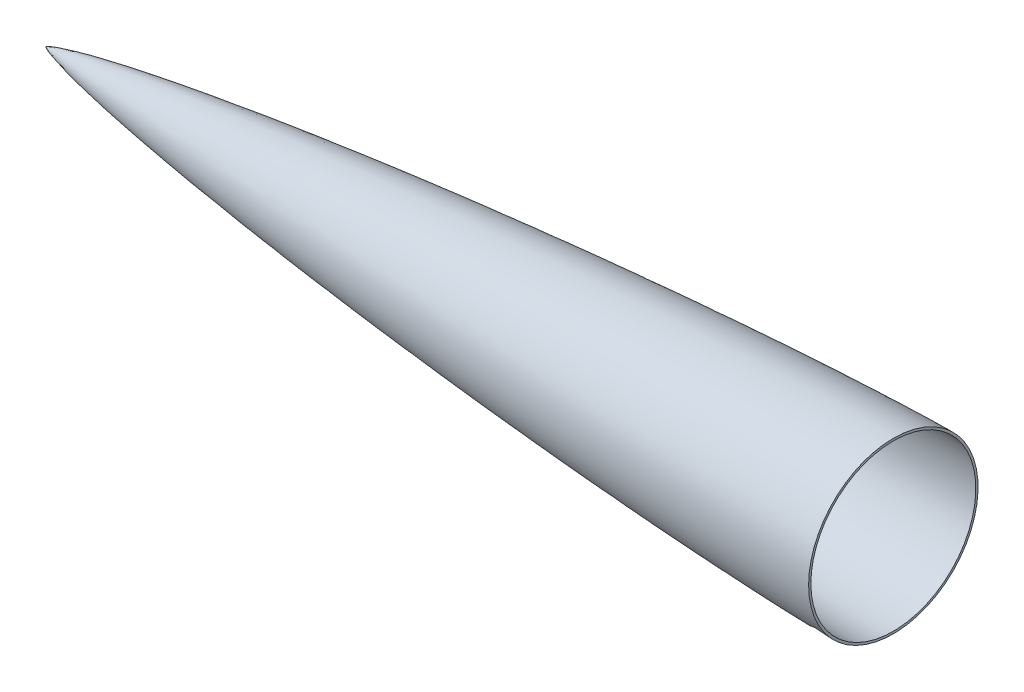
from build123d import *


with BuildPart() as part:
    # Sketch2 → Revolve1 (revolve)
    with BuildSketch(Plane.XY):
        with BuildLine():
            Line((0, 0), (4.552555597, 0))
            add(Edge.make_bspline(
                [(4.552555597, 0), (5.445018222, 0.324851789), (7.238985949, 0.923010218), (10.928879317, 2.035076929), (17.470823328, 3.796049572), (26.944450926, 6.017468658), (38.38710912, 8.424081686), (53.706714586, 11.398322285), (72.931846424, 14.792456575), (96.067919313, 18.526465576), (119.249807278, 22.00672428), (150.202374057, 26.376394952), (188.95728034, 31.415002087), (235.531471027, 36.945375998), (282.157954731, 42.042348478), (328.825989737, 46.759546557), (391.096739156, 52.583813797), (469.010319037, 59.042664613), (547.004359649, 64.433928433), (609.441331189, 68.031853787), (656.287575483, 70.324980762), (695.342084637, 71.829704962), (722.680234864, 72.586297012), (738.305795074, 72.888338901), (746.103809692, 72.990306515), (750.00497269, 73.000006182)],
                knots=[0.005736518, 0.005736518, 0.005736518, 0.005736518, 0.00962036, 0.013504202, 0.021271885, 0.036807252, 0.052342619, 0.067877986, 0.09894872, 0.130019453, 0.161090187, 0.192160921, 0.254302389, 0.316443856, 0.378585324, 0.440726791, 0.502868259, 0.627151194, 0.75143413, 0.813575597, 0.875717065, 0.937858532, 0.968929266, 0.984464633, 1, 1, 1, 1], degree=3))
            Line((750.00497269, 73.000006182), (750, 75))
            add(Edge.make_bspline(
                [(0, 0), (0.002661369, 0.00735768), (0.009108664, 0.021455176), (0.026858739, 0.047022825), (0.06841925, 0.093346235), (0.131428409, 0.1510252), (0.216810716, 0.21833703), (0.338162364, 0.304110587), (0.48394243, 0.397396692), (0.655054985, 0.498068807), (0.851568565, 0.605626998), (1.137654509, 0.753350528), (1.581543682, 0.966113556), (2.335050733, 1.296122672), (3.682901567, 1.826629283), (6.111473252, 2.674476309), (10.574628301, 4.037968264), (18.951733743, 6.252001296), (33.570100518, 9.565304084), (58.406653249, 14.407879587), (92.507874052, 20.12088369), (133.842049801, 26.225056743), (179.809214733, 32.306451647), (225.84209313, 37.86321125), (271.925422623, 42.983912816), (318.04912254, 47.72529812), (364.207064366, 52.120679156), (410.394737335, 56.191009866), (456.609131982, 59.945893406), (502.84798368, 63.386478656), (549.109760477, 66.50424795), (595.393392595, 69.279792224), (635.910176338, 71.377324916), (670.6520208, 72.898528506), (698.66827638, 73.906563077), (717.52848444, 74.458019085), (733.022602025, 74.804058757), (742.723636447, 74.948033977), (747.57448889, 74.993969324), (750, 75)],
                knots=[0, 0, 0, 0, 0, 4.1103e-05, 8.2207e-05, 0.000164413, 0.000328826, 0.000493239, 0.000657652, 0.000951494, 0.001245335, 0.001544792, 0.001844249, 0.002657057, 0.00385252, 0.005901677, 0.009515863, 0.016280764, 0.028569004, 0.051793804, 0.088907366, 0.150314205, 0.211721038, 0.273127872, 0.334534706, 0.395941541, 0.457348376, 0.518755211, 0.580162046, 0.641568881, 0.702975716, 0.764382551, 0.825789386, 0.887196222, 0.917899639, 0.948603057, 0.974301528, 0.987150764, 1, 1, 1, 1, 1], degree=4))
        make_face()
    revolve(axis=Axis((0, 0, 0), (1, 0, 0)))


solid = part.part
